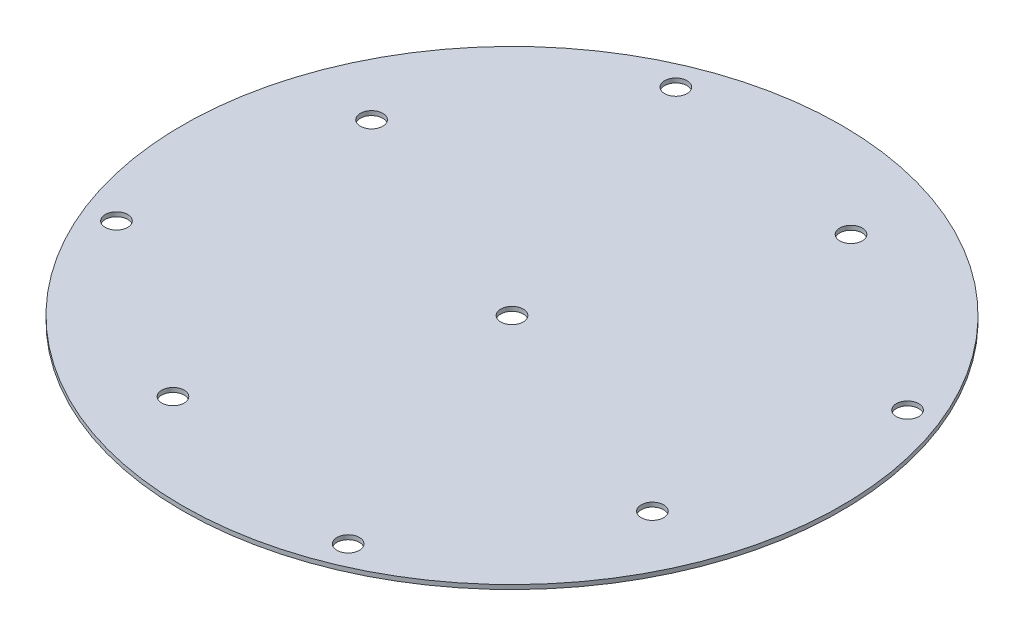
from build123d import *

# Parameters (mm, degrees)
SKETCH2_W                  = 76.2
SKETCH2_H                  = 1
F_6_0_204_DIAMETER_HOLE1_D = 5.1816
CIRPATTERN3_COUNT          = 4
F_6_0_204_DIAMETER_HOLE2_D = 5.1816


with BuildPart() as part:
    # Sketch2 → Revolve1 (revolve)
    with BuildSketch(Plane(origin=(0, 0, 0), x_dir=(0, 0, -1), z_dir=(1, 0, 0))):
        with Locations((-38.1, 0.5)):
            Rectangle(SKETCH2_W, SKETCH2_H)
    revolve(axis=Axis((0, -0.05, 0), (0, 1, 0)))

    # #6 (0.204) Diameter Hole1 (through all)
    with Locations(Plane(origin=(0, 1, 0), x_dir=(1, 0, 0), z_dir=(0, 1, 0))):
        with Locations((-26.787840266, 64.671567276), (264.743675233, 73.787758551), (-55.432771951, 22.961005942)):
            f_6_0_204_diameter_hole1 = Hole(F_6_0_204_DIAMETER_HOLE1_D / 2)

    # CirPattern3: #6 (0.204) Diameter Hole1 ×4 about axis
    cirpattern3_axis = Axis((0, -0.05, 0), (0, 1, 0))
    for i in range(1, CIRPATTERN3_COUNT):
        add(f_6_0_204_diameter_hole1.rotate(cirpattern3_axis, i * 360 / CIRPATTERN3_COUNT), mode=Mode.SUBTRACT)

    # #6 (0.204) Diameter Hole2 (through all)
    with Locations(Plane(origin=(0, 1, 0), x_dir=(1, 0, 0), z_dir=(0, 1, 0))):
        with Locations((0, 0)):
            Hole(F_6_0_204_DIAMETER_HOLE2_D / 2)


solid = part.part
